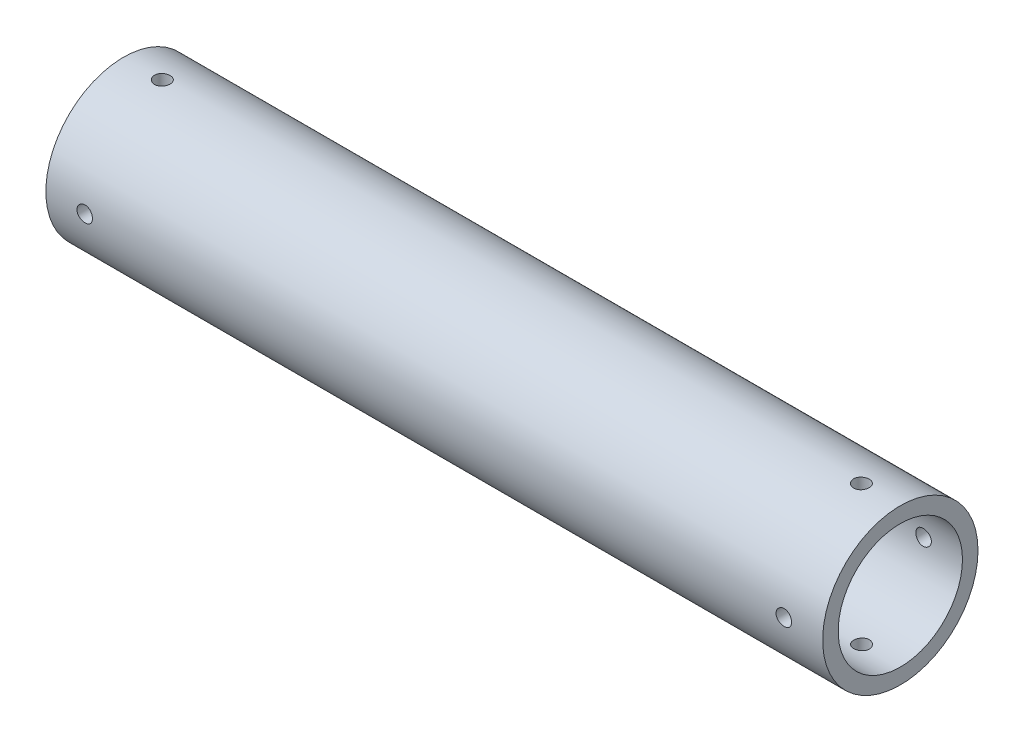
from build123d import *

# Parameters (mm, degrees)
SKETCH_2_R               = 20
SKETCH_2_R_2             = 16
EXTRUDE_2_DEPTH          = 200
SKETCH_4_R               = 2
CUT_EXTRUDE_2_DEPTH      = 10
PATTERN_CIRCULAR_1_COUNT = 4


with BuildPart() as part:
    # Эскиз2 → Бобышка-Вытянуть2 (new body)
    with BuildSketch(Plane(origin=(0, 0, 0), x_dir=(0, 0, -1), z_dir=(1, 0, 0))):
        Circle(SKETCH_2_R)
        Circle(SKETCH_2_R_2, mode=Mode.SUBTRACT)
    extrude(amount=EXTRUDE_2_DEPTH)

    # Эскиз4 → Вырез-Вытянуть2 (cut, symmetric)
    with BuildSketch(Plane.XY.offset(25)):
        with Locations((10, 0)):
            Circle(SKETCH_4_R)
        with Locations((190, 0)):
            Circle(SKETCH_4_R)
    cut_extrude_2 = extrude(amount=CUT_EXTRUDE_2_DEPTH, both=True, mode=Mode.SUBTRACT)

    # Круговой массив1: Вырез-Вытянуть2 ×4 about axis
    pattern_circular_1_axis = Axis((200, 0, 0), (-1, 0, 0))
    for i in range(1, PATTERN_CIRCULAR_1_COUNT):
        add(cut_extrude_2.rotate(pattern_circular_1_axis, i * 360 / PATTERN_CIRCULAR_1_COUNT), mode=Mode.SUBTRACT)


solid = part.part
